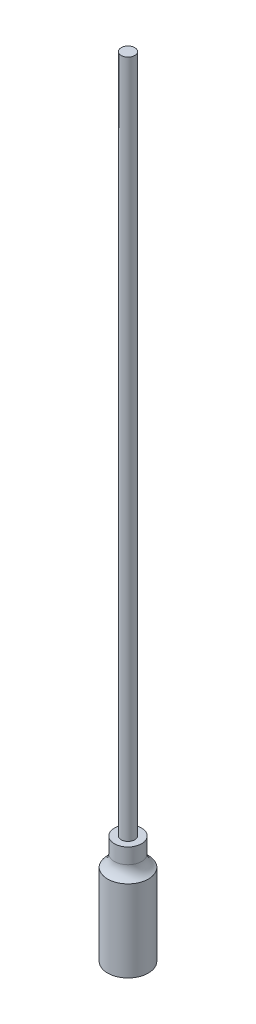
from build123d import *

# Parameters (mm, degrees)
SKETCH1_R           = 1.5
BOSS_EXTRUDE1_DEPTH = 6
SKETCH2_R           = 1
BOSS_EXTRUDE2_DEPTH = 2
FILLET1_R           = 1
SKETCH3_R           = 0.5
BOSS_EXTRUDE3_DEPTH = 50


with BuildPart() as part:
    # Sketch1 → Boss-Extrude1 (new body)
    with BuildSketch(Plane(origin=(0, 0, 0), x_dir=(1, 0, 0), z_dir=(0, 1, 0))):
        with Locations(Location((0, 0, 0), (0, 0, 270))):
            Circle(SKETCH1_R)
    extrude(amount=BOSS_EXTRUDE1_DEPTH)

    # Sketch2 → Boss-Extrude2 (add)
    with BuildSketch(Plane(origin=(0, 6, 0), x_dir=(1, 0, 0), z_dir=(0, 1, 0))):
        with Locations(Location((0, 0, 0), (0, 0, 270))):
            Circle(SKETCH2_R)
    extrude(amount=BOSS_EXTRUDE2_DEPTH)

    # Fillet1
    # the kernel refuses this fillet: 1 mm, written as the material it adds along each edge
    with BuildSketch(Plane(origin=(0, 6, 0), x_dir=(0, 0, 1), z_dir=(-1, 0, 0))) as fillet1_piece_1:
        with BuildLine():
            CenterArc((2, 0.866025404), FILLET1_R, 180, 60)
            Line((1, 0.866025404), (0.98, 0.866025404))
            Line((0.98, 0.866025404), (0.98, 0))
            Line((0.98, 0), (1, -0.02))
            ThreePointArc((1, -0.02), (1.25, -0.02), (1.49, -0.017320508))
            Line((1.49, -0.017320508), (1.5, 0))
        make_face()
    revolve(axis=Axis((0, 6, 0), (0, 1, 0)))

    # Sketch3 → Boss-Extrude3 (add)
    with BuildSketch(Plane(origin=(0, 8, 0), x_dir=(1, 0, 0), z_dir=(0, 1, 0))):
        with Locations(Location((0, 0, 0), (0, 0, 270))):
            Circle(SKETCH3_R)
    extrude(amount=BOSS_EXTRUDE3_DEPTH)


solid = part.part
